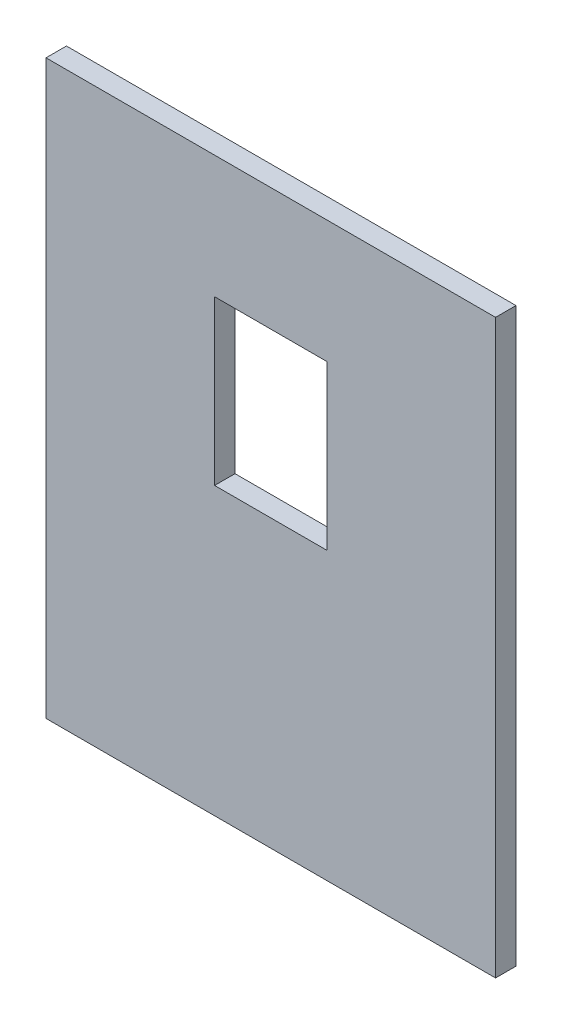
from build123d import *

# Parameters (mm, degrees)
ESQUISSE1_W                  = 220
ESQUISSE1_H                  = 280
BOSS_EXTRU_1_DEPTH           = 10
ESQUISSE2_R                  = 2
ENL_V_MAT_EXTRU_1_DEPTH      = 10
ENL_V_MAT_EXTRU_2_DEPTH      = 357.230262611
ENL_V_MAT_EXTRU_2_DEPTH_BACK = 357.230262611
ESQUISSE3_W                  = 55
ESQUISSE3_H                  = 80


with BuildPart() as part:
    # Esquisse1 → Boss.-Extru.1 (new body)
    with BuildSketch(Plane.XY):
        with Locations((110, 140)):
            Rectangle(ESQUISSE1_W, ESQUISSE1_H)
    extrude(amount=BOSS_EXTRU_1_DEPTH)

    # Esquisse2 → Enlèv. mat.-Extru.1 (cut)
    with BuildSketch(Plane.XZ):
        with Locations((110, 5)):
            Circle(ESQUISSE2_R)
        with Locations((210, 5)):
            Circle(ESQUISSE2_R)
        with Locations((10, 5)):
            Circle(ESQUISSE2_R)
    extrude(amount=-ENL_V_MAT_EXTRU_1_DEPTH, mode=Mode.SUBTRACT)

    # Esquisse3 → Enlèv. mat.-Extru.2 (cut, two sides: drawn at the far end of the back side and taken through both)
    with BuildSketch(Plane.XY.offset(10).offset(-ENL_V_MAT_EXTRU_2_DEPTH_BACK)):
        with Locations((110, 180)):
            Rectangle(ESQUISSE3_W, ESQUISSE3_H)
    extrude(amount=ENL_V_MAT_EXTRU_2_DEPTH + ENL_V_MAT_EXTRU_2_DEPTH_BACK, mode=Mode.SUBTRACT)


solid = part.part
